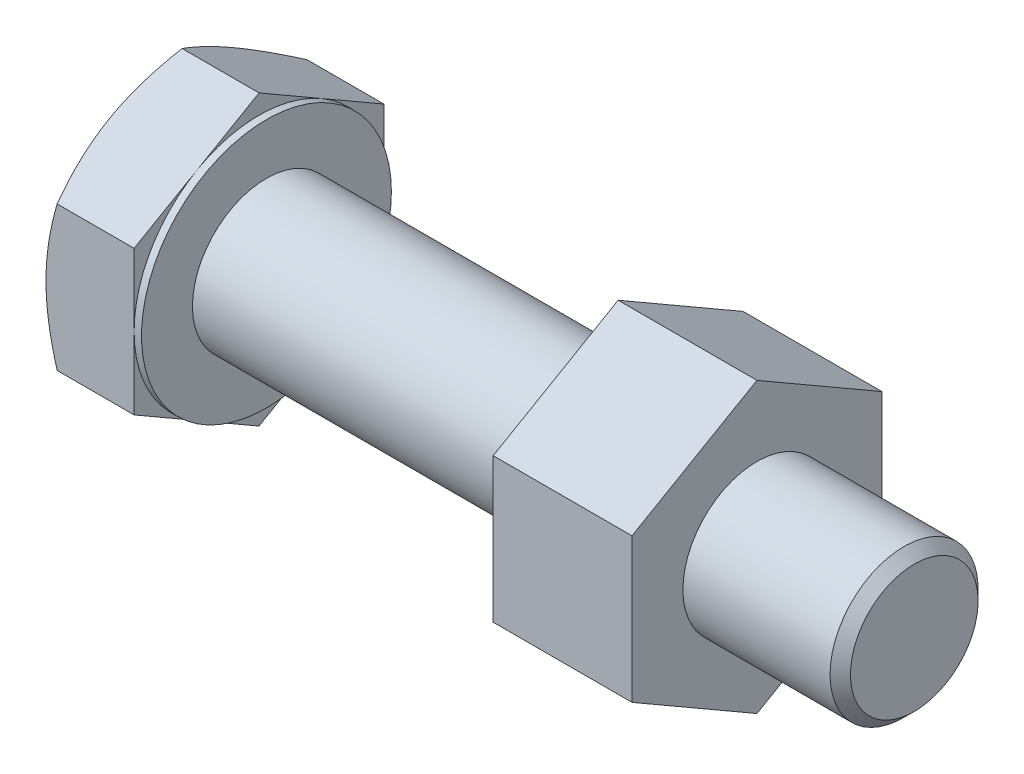
from build123d import *

# Parameters (mm, degrees)
BASEHEAD_DEPTH      = 10.32
SKETCH4_W           = 0.8
SKETCH4_H           = 12.088457268
BOSS_EXTRUDE2_DEPTH = 15


# Read off the part's stored shape, not the designer's step: HeadChamfer
with BuildPart() as part:
    # Sketch1 → BaseHead (new body)
    with BuildSketch(Plane(origin=(0, 0, 0), x_dir=(0, 0, -1), z_dir=(1, 0, 0))):
        Polygon((13.5, 7.794228634), (13.5, -7.794228634), (0, -15.588457268), (-13.5, -7.794228634), (-13.5, 7.794228634), (0, 15.588457268), align=None)
    extrude(amount=BASEHEAD_DEPTH)

    # HeadChamfer outline → HeadChamfer (revolve, cut)
    with BuildSketch(Plane.YX):
        Polygon((15.58845727, 1.205771367), (13.499999851, -8.6e-08), (15.58845727, -8.6e-08), align=None)
    revolve(axis=Axis((0, 0, 0), (1, 0, 0)), mode=Mode.SUBTRACT)

    # HeadChamfer 2 outline → HeadChamfer 2 (revolve)
    with BuildSketch(Plane.YX):
        Polygon((8, 10.32), (8, 79.2185), (6.8985, 80.32), (0, 80.32), (0, 10.32), align=None)
    revolve(axis=Axis((0, 0, 0), (1, 0, 0)))

    # Sketch4 → BearingFace (revolve, cut)
    with BuildSketch(Plane.XY, mode=Mode.PRIVATE) as bearingface_sk:
        with Locations((9.92, 19.544228634)):
            Rectangle(SKETCH4_W, SKETCH4_H)
    revolve(bearingface_sk.sketch.rotate(Axis((0, 0, 0), (1, 0, 0)), 90), axis=Axis((0, 0, 0), (1, 0, 0)), mode=Mode.SUBTRACT)

    # Sketch6 → Boss-Extrude2 (add)
    with BuildSketch(Plane(origin=(48.32, 0, 0), x_dir=(0, 0, -1), z_dir=(1, 0, 0))):
        Polygon((0, 15.588457268), (-13.5, 7.794228634), (-13.5, -7.794228634), (0, -15.588457268), (13.5, -7.794228634), (13.5, 7.794228634), align=None)
    extrude(amount=BOSS_EXTRUDE2_DEPTH)


solid = part.part
